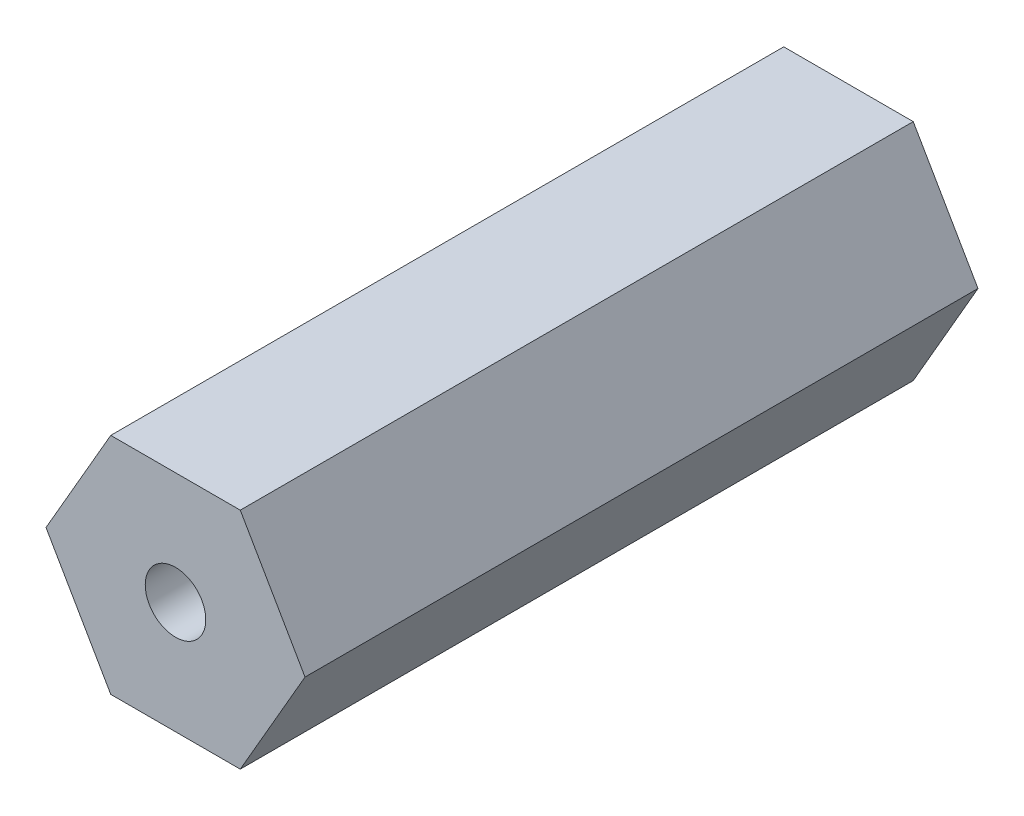
from build123d import *

# Parameters (mm, degrees)
SKETCH1_R           = 1.7145
BOSS_EXTRUDE1_DEPTH = 19.05


with BuildPart() as part:
    # Sketch1 → Boss-Extrude1 (new, symmetric)
    with BuildSketch(Plane.XY):
        Polygon((7.332348419, 0), (3.666174209, 6.35), (-3.666174209, 6.35), (-7.332348419, 0), (-3.666174209, -6.35), (3.666174209, -6.35), align=None)
        Circle(SKETCH1_R, mode=Mode.SUBTRACT)
    extrude(amount=BOSS_EXTRUDE1_DEPTH, both=True)


solid = part.part
